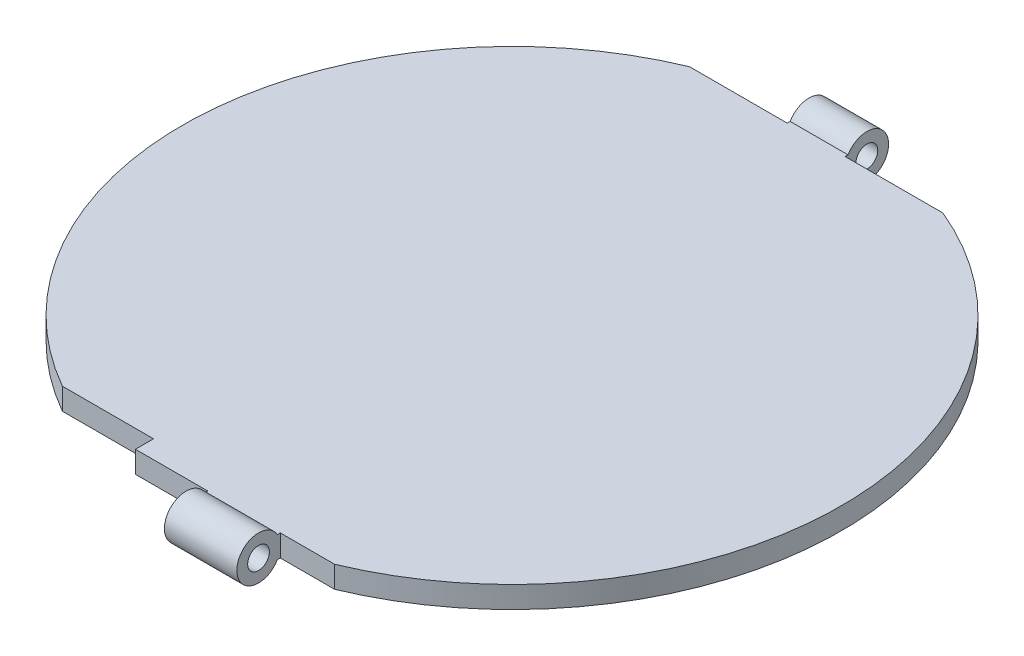
from build123d import *

# Parameters (mm, degrees)
BOSS_EXTRUDE1_DEPTH = 3
SKETCH2_R           = 1.5
BOSS_EXTRUDE2_DEPTH = 10
SKETCH3_W           = 8
SKETCH3_H           = 9
CUT_EXTRUDE1_DEPTH  = 10
SKETCH4_W           = 8
SKETCH4_H           = 9
CUT_EXTRUDE2_DEPTH  = 6
CUT_EXTRUDE3_REACH  = 75.515
SKETCH5_W           = 11
SKETCH5_H           = 12


with BuildPart() as part:
    # Sketch1 → Boss-Extrude1 (new body)
    with BuildSketch(Plane(origin=(0, 0, 0), x_dir=(1, 0, 0), z_dir=(0, 1, 0))):
        with BuildLine():
            Line((-17.5, -42), (17.5, -42))
            ThreePointArc((17.5, -42), (45.5, 0), (17.5, 42))
            Line((17.5, 42), (-17.5, 42))
            ThreePointArc((-17.5, 42), (-45.5, 0), (-17.5, -42))
        make_face()
    extrude(amount=BOSS_EXTRUDE1_DEPTH)

    # Sketch2 → Boss-Extrude2 (add, symmetric)
    with BuildSketch(Plane(origin=(0, 0, 0), x_dir=(0, 0, -1), z_dir=(1, 0, 0))):
        with BuildLine():
            Line((-42, 0), (-42.401923789, 0))
            ThreePointArc((-42.401923789, 0), (-48, 1.5), (-42.401923789, 3))
            Line((-42.401923789, 3), (-42, 3))
            Line((-42, 3), (-42, 1.5))
            Line((-42, 1.5), (-42, 0))
        make_face()
        with Locations((-45, 1.5)):
            Circle(SKETCH2_R, mode=Mode.SUBTRACT)
    boss_extrude2 = extrude(amount=BOSS_EXTRUDE2_DEPTH, both=True)

    # Mirror1: Boss-Extrude2 across plane
    add(boss_extrude2.mirror(Plane.XY))

    # Sketch3 → Cut-Extrude1 (cut)
    with BuildSketch(Plane.ZY.offset(10)):
        with Locations((46, 2)):
            Rectangle(SKETCH3_W, SKETCH3_H)
    extrude(amount=-CUT_EXTRUDE1_DEPTH, mode=Mode.SUBTRACT)

    # Sketch4 → Cut-Extrude2 (cut)
    with BuildSketch(Plane.ZY.offset(10)):
        with Locations((-46, 2)):
            Rectangle(SKETCH4_W, SKETCH4_H)
    cut_extrude2 = extrude(amount=-CUT_EXTRUDE2_DEPTH, mode=Mode.SUBTRACT)

    # Mirror2: Cut-Extrude2 across plane
    add(cut_extrude2.mirror(Plane(origin=(0, 0, 0), x_dir=(0, 0, 1), z_dir=(1, 0, 0))), mode=Mode.SUBTRACT)

    # Sketch5 → Cut-Extrude3 (cut, up to next)
    with BuildSketch(Plane.ZY.offset(10), mode=Mode.PRIVATE) as cut_extrude3_sk1:
        with Locations((45, 1.5)):
            Rectangle(SKETCH5_W, SKETCH5_H)
    cut_extrude3_tool1 = extrude(cut_extrude3_sk1.sketch, amount=CUT_EXTRUDE3_REACH, mode=Mode.PRIVATE) & part.part
    add(cut_extrude3_tool1.solids().sort_by_distance((-10, 1.5, 45))[0], mode=Mode.SUBTRACT)


solid = part.part
